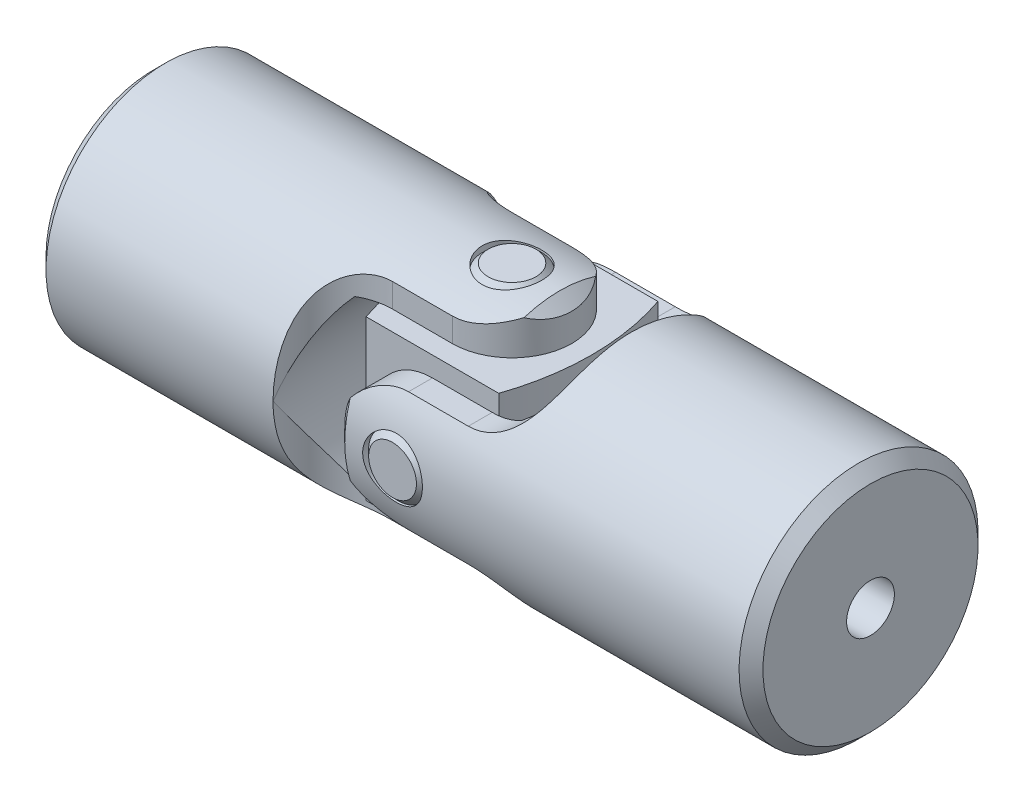
from build123d import *

# Parameters (mm, degrees)
CHAMFER1_SIZE         = 1.5875
EXTRUDE1_DEPTH        = 53.651418547
EXTRUDE1_DEPTH_BACK   = 53.651418547
EXTRUDE3_DEPTH        = 53.651418607
EXTRUDE3_DEPTH_BACK   = 53.651418607
SKETCH4_R             = 3.175
EXTRUDE4_DEPTH        = 6.35
EXTRUDE6_DEPTH        = 53.651418607
EXTRUDE6_DEPTH_BACK   = 53.651418607
SKETCH6_R             = 3.96875
BODY_MOVE_COPY1_ANGLE = 90
EXTRUDE10_START       = -10.57275
EXTRUDE10_OUTLINE_W   = 21.1455
EXTRUDE10_OUTLINE_H   = 21.1455
EXTRUDE10_DEPTH       = 21.1455
CUT_EXTRUDE2_DEPTH    = 57.741869361
EXTRUDE13_DEPTH       = 53.651418607
EXTRUDE13_DEPTH_BACK  = 53.651418607
SKETCH13_R            = 3.96875
SKETCH14_R            = 3.96875
EXTRUDE14_DEPTH       = 15.875
EXTRUDE15_DEPTH       = 53.651418607
EXTRUDE15_DEPTH_BACK  = 53.651418607
SKETCH15_R            = 3.96875
SKETCH16_R            = 3.96875
EXTRUDE16_DEPTH       = 15.875
CHAMFER3_SIZE         = 0.79375


# Read off the part's stored shape, not the designer's step: Extrude10
with BuildPart() as part:
    # Sketch1 → Revolve1 (revolve)
    with BuildSketch(Plane(origin=(0, 0, 0), x_dir=(1, 0, 0), z_dir=(0, 1, 0)), mode=Mode.PRIVATE) as revolve1_sk:
        Polygon((-47.625, 15.875), (-15.08125, 15.875), (7.9375, 15.875), (7.9375, 0), (-47.625, 0), align=None)
    revolve(revolve1_sk.sketch.rotate(Axis((-47.625, 0, 0), (1, 0, 0)), 180), axis=Axis((-47.625, 0, 0), (1, 0, 0)))

    # Chamfer1
    chamfer1_edges = [part.edges().sort_by_distance(p)[0] for p in [
        (7.9375, 0, -15.875),
        (-47.625, 0, -15.875),
    ]]
    chamfer(chamfer1_edges, length=CHAMFER1_SIZE)

    # Sketch2 → Extrude1 (cut, two sides: drawn at the far end of the back side and taken through both)
    with BuildSketch(Plane(origin=(0, 0, 0), x_dir=(1, 0, 0), z_dir=(0, 1, 0)).offset(-EXTRUDE1_DEPTH_BACK)):
        with BuildLine():
            Line((-15.875, 15.875), (15.875, 15.875))
            Line((15.875, 15.875), (15.875, -15.875))
            Line((15.875, -15.875), (-15.875, -15.875))
            ThreePointArc((-15.875, -15.875), (-13.550160076, -10.262339924), (-7.9375, -7.9375))
            Line((-7.9375, -7.9375), (0, -7.9375))
            ThreePointArc((0, -7.9375), (7.9375, 0), (0, 7.9375))
            Line((0, 7.9375), (-7.9375, 7.9375))
            ThreePointArc((-7.9375, 7.9375), (-13.550160076, 10.262339924), (-15.875, 15.875))
        make_face()
    extrude(amount=EXTRUDE1_DEPTH + EXTRUDE1_DEPTH_BACK, mode=Mode.SUBTRACT)

    # Sketch3 → Extrude3 (cut, two sides: drawn at the far end of the back side and taken through both)
    with BuildSketch(Plane.XY.offset(-EXTRUDE3_DEPTH_BACK)):
        with BuildLine():
            Line((-11.90625, 10.57275), (15.875, 10.57275))
            Line((15.875, 10.57275), (15.875, -10.57275))
            Line((15.875, -10.57275), (-11.90625, -10.57275))
            ThreePointArc((-11.90625, -10.57275), (-15.875, 0), (-11.90625, 10.57275))
        make_face()
    extrude(amount=EXTRUDE3_DEPTH + EXTRUDE3_DEPTH_BACK, mode=Mode.SUBTRACT)

    # Sketch4 → Extrude4 (cut)
    with BuildSketch(Plane.ZY.offset(47.625)):
        Circle(SKETCH4_R)
    extrude(amount=-EXTRUDE4_DEPTH, mode=Mode.SUBTRACT)

    # Extrude5 cone 1 section (through the dimple's axis) → Extrude5 (revolve, cut)
    with BuildSketch(Plane(origin=(-41.275, 0, 0), x_dir=(0, 0, 1), z_dir=(0, 1, 0))):
        Polygon((0, 0), (3.175, 0), (0, 3.175), align=None)
    revolve(axis=Axis((-41.275, 0, 0), (1, 0, 0)), mode=Mode.SUBTRACT)

    # Sketch6 → Extrude6 (cut, two sides: drawn at the far end of the back side and taken through both)
    with BuildSketch(Plane(origin=(0, 0, 0), x_dir=(1, 0, 0), z_dir=(0, 1, 0)).offset(-EXTRUDE6_DEPTH_BACK)):
        with Locations(Location((0, 0, 0), (0, 0, 270))):
            Circle(SKETCH6_R)
    extrude(amount=EXTRUDE6_DEPTH + EXTRUDE6_DEPTH_BACK, mode=Mode.SUBTRACT)


with BuildPart() as body_2:
    # Mirror1: mirrored copy
    add(part.part.mirror(Plane(origin=(0, 0, 0), x_dir=(0, 0, 1), z_dir=(1, 0, 0))))


with BuildPart() as body_2_1:
    # Body-Move/Copy1: moved
    add(body_2.part.rotate(Axis((0, 0, 0), (1, 0, 0)), BODY_MOVE_COPY1_ANGLE))


with BuildPart() as body_3:
    # Extrude10 outline → Extrude10 (new body)
    with BuildSketch(Plane.XY.offset(EXTRUDE10_START)):
        Rectangle(EXTRUDE10_OUTLINE_W, EXTRUDE10_OUTLINE_H)
    extrude(amount=EXTRUDE10_DEPTH)

    # Sketch20 → Cut-Extrude2 (cut, through all)
    with BuildSketch(Plane(origin=(0, 10.57275, 0), x_dir=(1, 0, 0), z_dir=(0, 1, 0))):
        with BuildLine():
            Line((11.58875, -11.58875), (11.58875, 11.58875))
            Line((11.58875, 11.58875), (8.810625, 11.58875))
            Line((8.810625, 11.58875), (8.810625, 10.57275))
            ThreePointArc((8.810625, 10.57275), (10.57275, 0), (8.810625, -10.57275))
            Line((8.810625, -10.57275), (8.810625, -11.58875))
            Line((8.810625, -11.58875), (11.58875, -11.58875))
        make_face()
        with BuildLine():
            Line((-11.58875, 11.58875), (-11.58875, -11.58875))
            Line((-11.58875, -11.58875), (-8.810625, -11.58875))
            Line((-8.810625, -11.58875), (-8.810625, -10.57275))
            ThreePointArc((-8.810625, -10.57275), (-10.57275, 0), (-8.810625, 10.57275))
            Line((-8.810625, 10.57275), (-8.810625, 11.58875))
            Line((-8.810625, 11.58875), (-11.58875, 11.58875))
        make_face()
    extrude(amount=-CUT_EXTRUDE2_DEPTH, mode=Mode.SUBTRACT)

    # Sketch13 → Extrude13 (cut, two sides: drawn at the far end of the back side and taken through both)
    with BuildSketch(Plane(origin=(0, 0, 0), x_dir=(1, 0, 0), z_dir=(0, 1, 0)).offset(-EXTRUDE13_DEPTH_BACK)):
        with Locations(Location((0, 0, 0), (0, 0, 270))):
            Circle(SKETCH13_R)
    extrude(amount=EXTRUDE13_DEPTH + EXTRUDE13_DEPTH_BACK, mode=Mode.SUBTRACT)

    # Sketch15 → Extrude15 (cut, two sides: drawn at the far end of the back side and taken through both)
    with BuildSketch(Plane.XY.offset(-EXTRUDE15_DEPTH_BACK)):
        Circle(SKETCH15_R)
    extrude(amount=EXTRUDE15_DEPTH + EXTRUDE15_DEPTH_BACK, mode=Mode.SUBTRACT)


with BuildPart() as body_4:
    # Sketch14 → Extrude14 (new, symmetric)
    with BuildSketch(Plane(origin=(0, 0, 0), x_dir=(1, 0, 0), z_dir=(0, 1, 0))):
        with Locations(Location((0, 0, 0), (0, 0, 270))):
            Circle(SKETCH14_R)
    extrude(amount=EXTRUDE14_DEPTH, both=True)

    # Sketch16 → Extrude16 (add, symmetric)
    with BuildSketch(Plane.XY):
        Circle(SKETCH16_R)
    extrude(amount=EXTRUDE16_DEPTH, both=True)

    # Chamfer3
    chamfer3_edges = [body_4.edges().sort_by_distance(p)[0] for p in [
        (0, -15.875, -3.96875),
        (0, 15.875, -3.96875),
        (-3.96875, 0, -15.875),
        (-3.96875, 0, 15.875),
    ]]
    chamfer(chamfer3_edges, length=CHAMFER3_SIZE)


solid = Compound([part.part, body_2_1.part, body_3.part, body_4.part])
